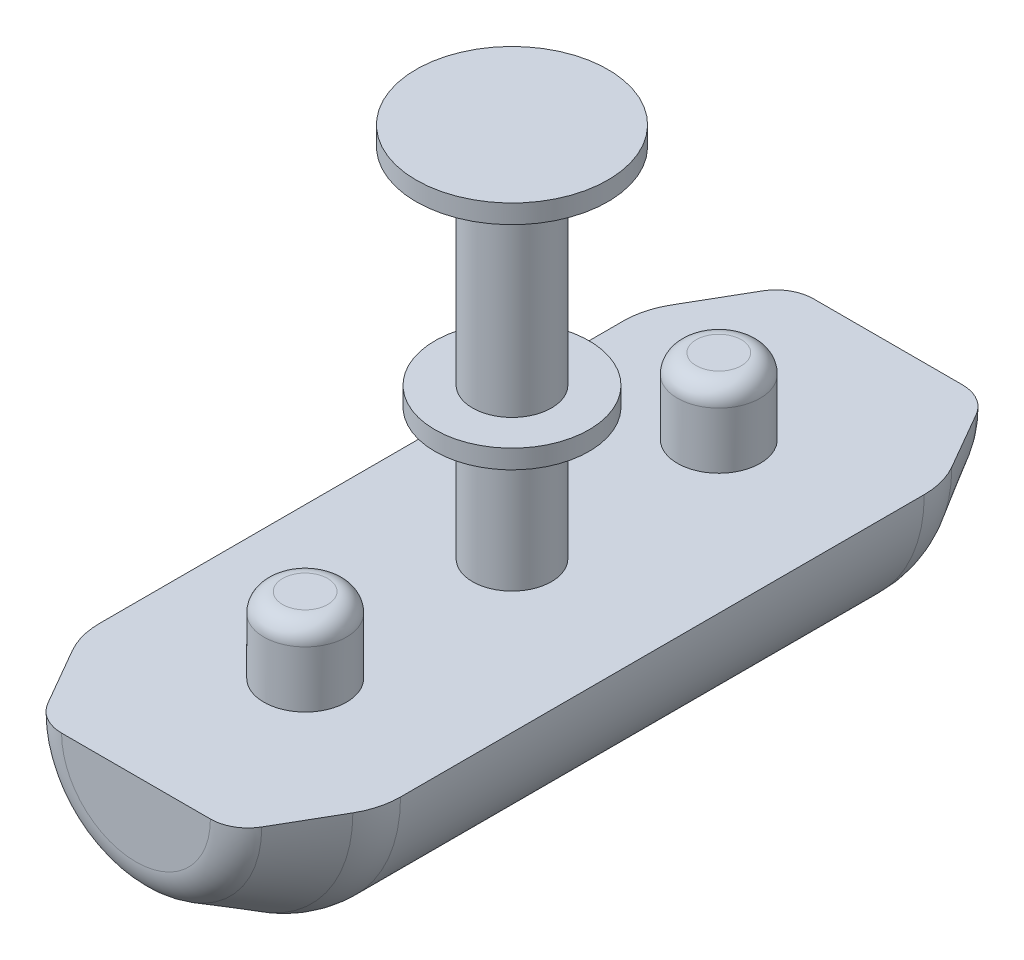
from build123d import *

# Parameters (mm, degrees)
SKETCH1_R            = 2.1
BOSS_EXTRUDE1_DEPTH  = 7
SKETCH2_R            = 4.1
BOSS_EXTRUDE2_DEPTH  = 1
SKETCH3_R            = 2.1
BOSS_EXTRUDE3_DEPTH  = 11
SKETCH4_R            = 5.1
BOSS_EXTRUDE4_DEPTH  = 1
BOSS_EXTRUDE5_DEPTH  = 15
REVOLVE1_ANGLE       = 180
FILLET1_R            = 4
FILLET2_R            = 2
FILLET1_OF_MIRROR1_R = 4
FILLET2_OF_MIRROR1_R = 2
SKETCH8_R            = 2.2
BOSS_EXTRUDE6_DEPTH  = 4
FILLET3_R            = 1


# Read off the part's stored shape, not the designer's step: Revolve1
with BuildPart() as part:
    # Sketch1 → Boss-Extrude1 (new body)
    with BuildSketch(Plane(origin=(0, 0, 0), x_dir=(1, 0, 0), z_dir=(0, 1, 0))):
        with Locations(Location((0, 0, 0), (0, 0, 270))):
            Circle(SKETCH1_R)
    extrude(amount=BOSS_EXTRUDE1_DEPTH)

    # Sketch2 → Boss-Extrude2 (add)
    with BuildSketch(Plane(origin=(0, 7, 0), x_dir=(1, 0, 0), z_dir=(0, 1, 0))):
        with Locations(Location((0, 0, 0), (0, 0, 270))):
            Circle(SKETCH2_R)
    extrude(amount=BOSS_EXTRUDE2_DEPTH)

    # Sketch3 → Boss-Extrude3 (add)
    with BuildSketch(Plane(origin=(0, 8, 0), x_dir=(1, 0, 0), z_dir=(0, 1, 0))):
        with Locations(Location((0, 0, 0), (0, 0, 270))):
            Circle(SKETCH3_R)
    extrude(amount=BOSS_EXTRUDE3_DEPTH)

    # Sketch4 → Boss-Extrude4 (add)
    with BuildSketch(Plane(origin=(0, 19, 0), x_dir=(1, 0, 0), z_dir=(0, 1, 0))):
        with Locations(Location((0, 0, 0), (0, 0, 270))):
            Circle(SKETCH4_R)
    extrude(amount=BOSS_EXTRUDE4_DEPTH)


with BuildPart() as body_2:
    # Sketch5 → Boss-Extrude5 (new, symmetric)
    with BuildSketch(Plane.XY):
        with BuildLine():
            Line((0, 0), (-8, 0))
            ThreePointArc((-8, 0), (0, -8), (8, 0))
            Line((8, 0), (0, 0))
        make_face()
    extrude(amount=BOSS_EXTRUDE5_DEPTH, both=True)

    # Revolve1 outline → Revolve1 (revolve)
    with BuildSketch(Plane(origin=(0, 0, 0), x_dir=(-1, 0, 0), z_dir=(0, 1, 0))):
        Polygon((0, -15), (0, -20), (5.113248654, -20), (8, -15), align=None)
    revolve1 = revolve(axis=Axis((0, 0, 0), (0, 0, 1)), revolution_arc=REVOLVE1_ANGLE)

    # Fillet1
    fillet1_edges = [body_2.edges().sort_by_distance(p)[0] for p in [
        (0, -8, -15),
    ]]
    fillet(fillet1_edges, radius=FILLET1_R)

    # Fillet2
    fillet2_edges = [body_2.edges().sort_by_distance(p)[0] for p in [
        (0, -5.113248654, -20),
    ]]
    fillet(fillet2_edges, radius=FILLET2_R)

    # Mirror1: Revolve1 across plane
    add(revolve1.mirror(Plane.XY))

    # Fillet1 of Mirror1
    fillet1_of_mirror1_edges = [body_2.edges().sort_by_distance(p)[0] for p in [
        (0, -8, 15),
    ]]
    fillet(fillet1_of_mirror1_edges, radius=FILLET1_OF_MIRROR1_R)

    # Fillet2 of Mirror1
    fillet2_of_mirror1_edges = [body_2.edges().sort_by_distance(p)[0] for p in [
        (0, -5.113248654, 20),
    ]]
    fillet(fillet2_of_mirror1_edges, radius=FILLET2_OF_MIRROR1_R)

    # Sketch8 → Boss-Extrude6 (add)
    with BuildSketch(Plane(origin=(0, 0, 0), x_dir=(1, 0, 0), z_dir=(0, 1, 0))):
        with Locations(Location((0, -11, 0), (0, 0, 90))):
            Circle(SKETCH8_R)
        with Locations(Location((0, 11, 0), (0, 0, 90))):
            Circle(SKETCH8_R)
    extrude(amount=BOSS_EXTRUDE6_DEPTH)

    # Fillet3
    fillet3_edges = [body_2.edges().sort_by_distance(p)[0] for p in [
        (0, 4, 13.2),
        (0, 4, -8.8),
    ]]
    fillet(fillet3_edges, radius=FILLET3_R)


solid = Compound([part.part, body_2.part])
